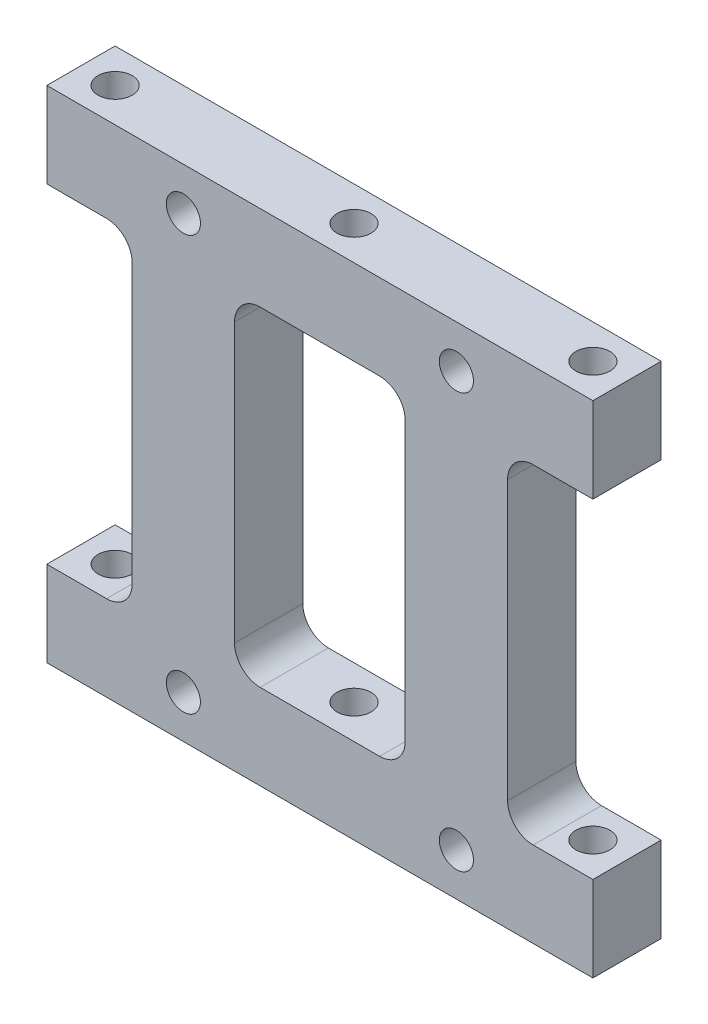
from build123d import *

# Parameters (mm, degrees)
EXTRUDE_1_DEPTH      = 8
FILLET_1_R           = 3
SKETCH_3_R           = 2
CUT_EXTRUDE_1_DEPTH  = 60
SKETCH_4_R           = 2
CUT_EXTRUDE_2_DEPTH  = 50
MIRROR_1_OUTLINE_R   = 2
MIRROR_1_DEPTH       = 1.9999999
MIRROR_START         = 6.0000001
MIRROR_1_2_OUTLINE_R = 2
MIRROR_1_2_DEPTH     = 1.9999999
MIRROR_START_2       = 1.9999999
MIRROR_1_3_OUTLINE_R = 2
MIRROR_1_3_DEPTH     = 4.0000002
MIRROR_START_3       = -1
MIRROR_1_4_OUTLINE_R = 2
MIRROR_1_4_DEPTH     = 61
SKETCH_5_R           = 2
CUT_EXTRUDE_3_DEPTH  = 100


with BuildPart() as part:
    # 草图1 → 凸台-拉伸1 (new body)
    with BuildSketch(Plane.XY):
        Polygon((0, 0), (32, 0), (32, 10), (22, 10), (22, 48.6), (32, 48.6), (32, 58.6), (0, 58.6), (0, 48.6), (10, 48.6), (10, 10), (0, 10), align=None)
    extrude(amount=EXTRUDE_1_DEPTH)

    # 圆角1
    fillet_1_edges = [part.edges().sort_by_distance(p)[0] for p in [
        (10, 10, 4),
        (10, 48.6, 4),
        (22, 48.6, 4),
        (22, 10, 4),
    ]]
    fillet(fillet_1_edges, radius=FILLET_1_R)

    # 草图3 → 切除-拉伸1 (cut)
    with BuildSketch(Plane(origin=(0, 58.6, 0), x_dir=(1, 0, 0), z_dir=(0, 1, 0))):
        with Locations(Location((4, -4, 0), (0, 0, 270))):
            Circle(SKETCH_3_R)
    extrude(amount=-CUT_EXTRUDE_1_DEPTH, mode=Mode.SUBTRACT)

    # 草图4 → 切除-拉伸2 (cut)
    with BuildSketch(Plane.XY.offset(8)):
        with Locations((16, 53.6)):
            Circle(SKETCH_4_R)
        with Locations(Location((16, 5, 0), (0, 0, 180))):
            Circle(SKETCH_4_R)
    extrude(amount=-CUT_EXTRUDE_2_DEPTH, mode=Mode.SUBTRACT)

    # 镜向1: read off the stored shape, not the designer's step
    # 镜向1 outline → 镜向1 (add)
    with BuildSketch(Plane.XY):
        with BuildLine():
            Line((32, 0), (64, 0))
            Line((64, 0), (64, 10))
            Line((64, 10), (57, 10))
            ThreePointArc((57, 10), (54.878679656, 10.878679656), (54, 13))
            Line((54, 13), (54, 45.6))
            ThreePointArc((54, 45.6), (54.878679656, 47.721320344), (57, 48.6))
            Line((57, 48.6), (64, 48.6))
            Line((64, 48.6), (64, 58.6))
            Line((64, 58.6), (32, 58.6))
            Line((32, 58.6), (32, 48.6))
            Line((32, 48.6), (39, 48.6))
            ThreePointArc((39, 48.6), (41.121320344, 47.721320344), (42, 45.6))
            Line((42, 45.6), (42, 13))
            ThreePointArc((42, 13), (41.121320344, 10.878679656), (39, 10))
            Line((39, 10), (32, 10))
            Line((32, 10), (32, 0))
        make_face()
        with Locations((48, 5)):
            Circle(MIRROR_1_OUTLINE_R, mode=Mode.SUBTRACT)
        with Locations((48, 53.6)):
            Circle(MIRROR_1_OUTLINE_R, mode=Mode.SUBTRACT)
    extrude(amount=MIRROR_1_DEPTH)

    # Mirror 1 2 outline → Mirror 1 2 (add)
    with BuildSketch(Plane.XY.offset(MIRROR_START)):
        with BuildLine():
            Line((32, 0), (64, 0))
            Line((64, 0), (64, 10))
            Line((64, 10), (57, 10))
            ThreePointArc((57, 10), (54.878679656, 10.878679656), (54, 13))
            Line((54, 13), (54, 45.6))
            ThreePointArc((54, 45.6), (54.878679656, 47.721320344), (57, 48.6))
            Line((57, 48.6), (64, 48.6))
            Line((64, 48.6), (64, 58.6))
            Line((64, 58.6), (32, 58.6))
            Line((32, 58.6), (32, 48.6))
            Line((32, 48.6), (39, 48.6))
            ThreePointArc((39, 48.6), (41.121320344, 47.721320344), (42, 45.6))
            Line((42, 45.6), (42, 13))
            ThreePointArc((42, 13), (41.121320344, 10.878679656), (39, 10))
            Line((39, 10), (32, 10))
            Line((32, 10), (32, 0))
        make_face()
        with Locations((48, 5)):
            Circle(MIRROR_1_2_OUTLINE_R, mode=Mode.SUBTRACT)
        with Locations((48, 53.6)):
            Circle(MIRROR_1_2_OUTLINE_R, mode=Mode.SUBTRACT)
    extrude(amount=MIRROR_1_2_DEPTH)

    # Mirror 1 3 outline → Mirror 1 3 (add)
    with BuildSketch(Plane.XY.offset(MIRROR_START_2)):
        with BuildLine():
            Line((32, 0), (64, 0))
            Line((64, 0), (64, 10))
            Line((64, 10), (57, 10))
            ThreePointArc((57, 10), (54.878679656, 10.878679656), (54, 13))
            Line((54, 13), (54, 45.6))
            ThreePointArc((54, 45.6), (54.878679656, 47.721320344), (57, 48.6))
            Line((57, 48.6), (64, 48.6))
            Line((64, 48.6), (64, 58.6))
            Line((64, 58.6), (32, 58.6))
            Line((32, 58.6), (32, 48.6))
            Line((32, 48.6), (39, 48.6))
            ThreePointArc((39, 48.6), (41.121320344, 47.721320344), (42, 45.6))
            Line((42, 45.6), (42, 13))
            ThreePointArc((42, 13), (41.121320344, 10.878679656), (39, 10))
            Line((39, 10), (32, 10))
            Line((32, 10), (32, 0))
        make_face()
        with Locations((48, 5)):
            Circle(MIRROR_1_3_OUTLINE_R, mode=Mode.SUBTRACT)
        with Locations((48, 53.6)):
            Circle(MIRROR_1_3_OUTLINE_R, mode=Mode.SUBTRACT)
    extrude(amount=MIRROR_1_3_DEPTH)

    # Mirror 1 4 outline → Mirror 1 4 (cut)
    with BuildSketch(Plane(origin=(0, 0, 0), x_dir=(1, 0, 0), z_dir=(0, 1, 0)).offset(MIRROR_START_3)):
        with Locations((60, -4)):
            Circle(MIRROR_1_4_OUTLINE_R)
    extrude(amount=MIRROR_1_4_DEPTH, mode=Mode.SUBTRACT)

    # 草图5 → 切除-拉伸3 (cut)
    with BuildSketch(Plane.XZ):
        with Locations(Location((32, 4, 0), (0, 0, 270))):
            Circle(SKETCH_5_R)
    extrude(amount=-CUT_EXTRUDE_3_DEPTH, mode=Mode.SUBTRACT)


solid = part.part
